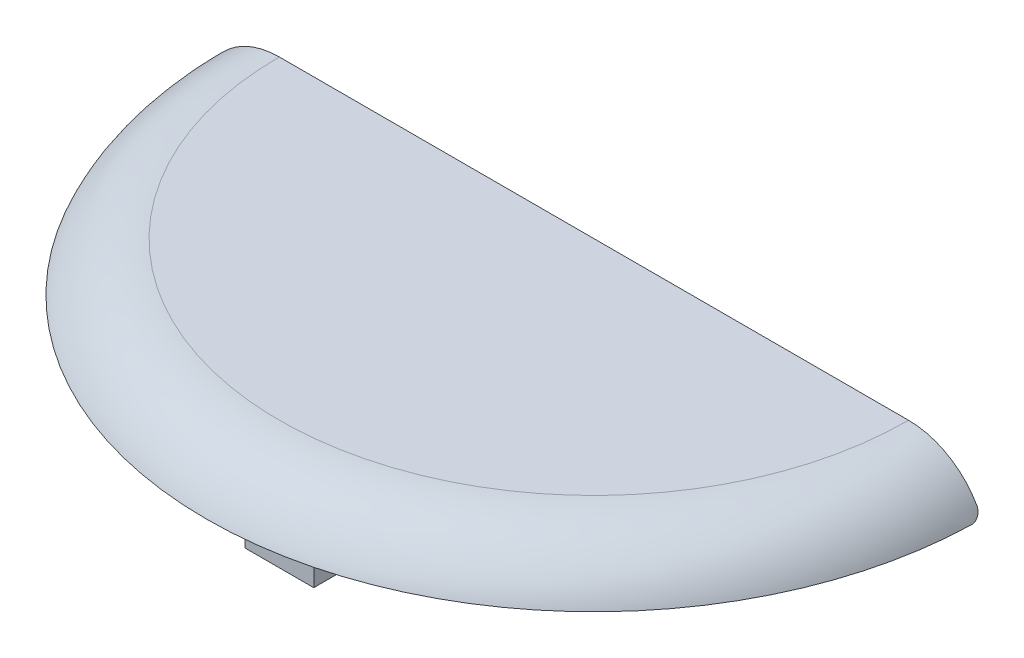
from build123d import *

# Parameters (mm, degrees)
CUT_EXTRUDE3_DEPTH           = 60
CUT_EXTRUDE5_DEPTH           = 2
CUT_EXTRUDE5_DEPTH_BACK      = 30
SKETCH9_R                    = 38
SKETCH9_R_2                  = 23
SKETCH19_W                   = 12
SKETCH19_H                   = 36.5
CUT_REVOLVE2_ANGLE           = 65
CUT_REVOLVE2_OTHER_WAY_ANGLE = 65
SKETCH21_W                   = 3.25
SKETCH21_H                   = 4
BOSS_EXTRUDE3_DEPTH          = 1.35
CIRPATTERN1_COUNT            = 5
CUT_EXTRUDE9_START           = -5
CUT_EXTRUDE9_DEPTH           = 5
SKETCH23_R                   = 10.5
CUT_EXTRUDE10_DEPTH          = 10
SKETCH24_W                   = 15
SKETCH24_H                   = 8
BOSS_EXTRUDE4_DEPTH          = 8
SKETCH26_W                   = 10
SKETCH26_H                   = 6
CUT_EXTRUDE11_DEPTH          = 10
SKETCH27_W                   = 4
SKETCH27_H                   = 5
CUT_EXTRUDE12_DEPTH          = 5
CUT_EXTRUDE14_DEPTH          = 2
CUT_EXTRUDE14_DEPTH_BACK     = 30
SKETCH29_R                   = 1
CUT_EXTRUDE15_DEPTH          = 15
FILLET1_R                    = 6
FILLET2_R                    = 8
INTERSECT1_DEPTH             = 58.427876097
SKETCH31_W                   = 7
SKETCH31_H                   = 5
BOSS_EXTRUDE7_DEPTH          = 8
SKETCH32_R                   = 1
CUT_EXTRUDE16_DEPTH          = 7.5
FILLET3_R                    = 1


# Read off the part's stored shape, not the designer's step: Cut-Extrude9, Intersect1
with BuildPart() as part:
    # Sketch1 → Revolve1 (revolve)
    with BuildSketch(Plane.XY, mode=Mode.PRIVATE) as revolve1_sk:
        with BuildLine():
            Line((0, 63.427876097), (32, 63.427876097))
            ThreePointArc((32, 63.427876097), (37.656854249, 61.084730346), (40, 55.427876097))
            Line((40, 55.427876097), (40, 28.846818009))
            ThreePointArc((40, 28.846818009), (38.792081772, 24.082439968), (35.460140376, 20.469057744))
            Line((35.460140376, 20.469057744), (28.539859624, 15.958818353))
            ThreePointArc((28.539859624, 15.958818353), (25.207918228, 12.345436129), (24, 7.581058088))
            Line((24, 7.581058088), (24, 3.25))
            Line((24, 3.25), (24.35, 3))
            Line((24.35, 3), (24.35, 0))
            Line((24.35, 0), (22.5, 0))
            Line((22.5, 0), (22.5, 12.5))
            ThreePointArc((22.5, 12.5), (22.353553391, 12.853553391), (22, 13))
            Line((22, 13), (0, 13))
            Line((0, 13), (0, 63.427876097))
        make_face()
    revolve(revolve1_sk.sketch.rotate(Axis((0, 0, 0), (0, 1, 0)), 90), axis=Axis((0, 0, 0), (0, 1, 0)))

    # Sketch11 → Cut-Extrude3 (cut)
    with BuildSketch(Plane(origin=(0, 13, 0), x_dir=(-1, 0, 0), z_dir=(0, -1, 0))):
        with BuildLine():
            Line((-21, 0), (21, 0))
            ThreePointArc((21, 0), (0, 21), (-21, 0))
        make_face()
    extrude(amount=-CUT_EXTRUDE3_DEPTH, mode=Mode.SUBTRACT)

    # Sketch9 → Cut-Extrude5 (cut, two sides: drawn at the far end of the back side and taken through both)
    with BuildSketch(Plane(origin=(0, 55.427876097, 0), x_dir=(1, 0, 0), z_dir=(0, 1, 0)).offset(-CUT_EXTRUDE5_DEPTH_BACK)):
        with Locations(Location((0, 0, 0), (0, 0, 270))):
            Circle(SKETCH9_R)
        with Locations(Location((0, 0, 0), (0, 0, 270))):
            Circle(SKETCH9_R_2, mode=Mode.SUBTRACT)
    extrude(amount=CUT_EXTRUDE5_DEPTH + CUT_EXTRUDE5_DEPTH_BACK, mode=Mode.SUBTRACT)

    # Sketch19 → Cut-Revolve2 (revolve, cut)
    with BuildSketch(Plane(origin=(0, 0, 0), x_dir=(0, 0, -1), z_dir=(1, 0, 0))):
        with Locations((-41.064715832, 37.177876097)):
            Rectangle(SKETCH19_W, SKETCH19_H)
    revolve(axis=Axis((0, 0, 0), (0, 1, 0)), revolution_arc=CUT_REVOLVE2_ANGLE, mode=Mode.SUBTRACT)

    # Sketch19 → Cut-Revolve2 other way (revolve, cut)
    with BuildSketch(Plane(origin=(0, 0, 0), x_dir=(0, 0, -1), z_dir=(1, 0, 0))):
        with Locations((-41.064715832, 37.177876097)):
            Rectangle(SKETCH19_W, SKETCH19_H)
    revolve(axis=Axis((0, 0, 0), (0, -1, 0)), revolution_arc=CUT_REVOLVE2_OTHER_WAY_ANGLE, mode=Mode.SUBTRACT)

    # Sketch21 → Boss-Extrude3 (add)
    with BuildSketch(Plane(origin=(0, 0, 22.5), x_dir=(-1, 0, 0), z_dir=(0, 0, -1))):
        with Locations((0, 2)):
            Rectangle(SKETCH21_W, SKETCH21_H)
    boss_extrude3 = extrude(amount=BOSS_EXTRUDE3_DEPTH)

    # CirPattern1: Boss-Extrude3 ×5 about axis
    cirpattern1_axis = Axis((0, 0, 0), (0, 1, 0))
    for i in range(1, CIRPATTERN1_COUNT):
        add(boss_extrude3.rotate(cirpattern1_axis, i * 360 / CIRPATTERN1_COUNT))

    # Cut-Extrude9 outline → Cut-Extrude9 (cut)
    with BuildSketch(Plane(origin=(0, 63.427876097, 0), x_dir=(1, 0, 0), z_dir=(0, 1, 0)).offset(CUT_EXTRUDE9_START)):
        with BuildLine():
            ThreePointArc((40, 0), (0, 40), (-40, 0))
            Line((-40, 0), (-21, 0))
            ThreePointArc((-21, 0), (0, 21), (21, 0))
            Line((21, 0), (40, 0))
        make_face()
    extrude(amount=CUT_EXTRUDE9_DEPTH, mode=Mode.SUBTRACT)

    # Sketch23 → Cut-Extrude10 (cut)
    with BuildSketch(Plane(origin=(0, 0, -40), x_dir=(-1, 0, 0), z_dir=(0, 0, -1))):
        with Locations((0, 42.137876097)):
            Circle(SKETCH23_R)
    extrude(amount=-CUT_EXTRUDE10_DEPTH, mode=Mode.SUBTRACT)

    # Sketch24 → Boss-Extrude4 (add)
    with BuildSketch(Plane(origin=(0, 58.427876097, 0), x_dir=(1, 0, 0), z_dir=(0, 1, 0))):
        with Locations((0, 30)):
            Rectangle(SKETCH24_W, SKETCH24_H)
    extrude(amount=-BOSS_EXTRUDE4_DEPTH)

    # Sketch26 → Cut-Extrude11 (cut)
    with BuildSketch(Plane(origin=(0, 58.427876097, 0), x_dir=(1, 0, 0), z_dir=(0, 1, 0))):
        with Locations((0, 30)):
            Rectangle(SKETCH26_W, SKETCH26_H)
    extrude(amount=-CUT_EXTRUDE11_DEPTH, mode=Mode.SUBTRACT)

    # Sketch27 → Cut-Extrude12 (cut)
    with BuildSketch(Plane(origin=(7.5, 0, 0), x_dir=(0, 0, -1), z_dir=(1, 0, 0))):
        with Locations((30, 53.927876097)):
            Rectangle(SKETCH27_W, SKETCH27_H)
    extrude(amount=-CUT_EXTRUDE12_DEPTH, mode=Mode.SUBTRACT)

    # Sketch28 → Cut-Extrude14 (cut, two sides: drawn at the far end of the back side and taken through both)
    with BuildSketch(Plane(origin=(0, 55.427876097, 0), x_dir=(1, 0, 0), z_dir=(0, 1, 0)).offset(-CUT_EXTRUDE14_DEPTH_BACK)):
        with BuildLine():
            Line((-22.912878475, -2), (22.912878475, -2))
            ThreePointArc((22.912878475, -2), (0, -23), (-22.912878475, -2))
        make_face()
    extrude(amount=CUT_EXTRUDE14_DEPTH + CUT_EXTRUDE14_DEPTH_BACK, mode=Mode.SUBTRACT)

    # Sketch29 → Cut-Extrude15 (cut)
    with BuildSketch(Plane(origin=(0, 0, 0), x_dir=(-1, 0, 0), z_dir=(0, 0, -1))):
        with Locations((-30.416198487, 60.927876097)):
            Circle(SKETCH29_R)
        with Locations((30.416198487, 60.927876097)):
            Circle(SKETCH29_R)
        with Locations((0, 60.927876097)):
            Circle(SKETCH29_R)
    extrude(amount=-CUT_EXTRUDE15_DEPTH, mode=Mode.SUBTRACT)

    # Fillet1
    fillet1_edges = [part.edges().sort_by_distance(p)[0] for p in [
        (21, 35.713938048, 0),
        (-21, 35.713938048, 0),
    ]]
    fillet(fillet1_edges, radius=FILLET1_R)

    # Fillet2
    fillet2_edges = [part.edges().sort_by_distance(p)[0] for p in [
        (-22.912878475, 41.427876097, 2),
        (22.912878475, 41.427876097, 2),
    ]]
    fillet(fillet2_edges, radius=FILLET2_R)

    # Intersect1 outline → Intersect1 (cut)
    with BuildSketch(Plane(origin=(0, 0, 0), x_dir=(1, 0, 0), z_dir=(0, 1, 0))):
        with BuildLine():
            Line((-37.508702776, -13.895942431), (-42, -15.355253362))
            Line((-42, -15.355253362), (-42, -41))
            Line((-42, -41), (42, -41))
            Line((42, -41), (42, -15.355253362))
            Line((42, -15.355253362), (37.508702776, -13.895942431))
            ThreePointArc((37.508702776, -13.895942431), (0, 40), (-37.508702776, -13.895942431))
        make_face()
        with BuildLine():
            ThreePointArc((19.246817919, 8.4), (18.767687244, 2.713664655), (13.747727085, 0))
            Line((13.747727085, 0), (-13.747727085, 0))
            ThreePointArc((-13.747727085, 0), (-18.767687244, 2.713664655), (-19.246817919, 8.4))
            ThreePointArc((-19.246817919, 8.4), (0, 21), (19.246817919, 8.4))
        make_face(mode=Mode.SUBTRACT)
    extrude(amount=INTERSECT1_DEPTH, mode=Mode.SUBTRACT)

    # Sketch31 → Boss-Extrude7 (add)
    with BuildSketch(Plane(origin=(0, 58.427876097, 0), x_dir=(1, 0, 0), z_dir=(0, 1, 0))):
        with Locations((0, -29.5)):
            Rectangle(SKETCH31_W, SKETCH31_H)
    extrude(amount=-BOSS_EXTRUDE7_DEPTH)

    # Sketch32 → Cut-Extrude16 (cut)
    with BuildSketch(Plane(origin=(3.5, 0, 0), x_dir=(0, 0, -1), z_dir=(1, 0, 0))):
        with Locations((-29.5, 54.427876097)):
            Circle(SKETCH32_R)
    extrude(amount=-CUT_EXTRUDE16_DEPTH, mode=Mode.SUBTRACT)

    # Fillet3
    fillet3_edges = [part.edges().sort_by_distance(p)[0] for p in [
        (0, 58.427876097, 0),
    ]]
    fillet(fillet3_edges, radius=FILLET3_R)


solid = part.part
